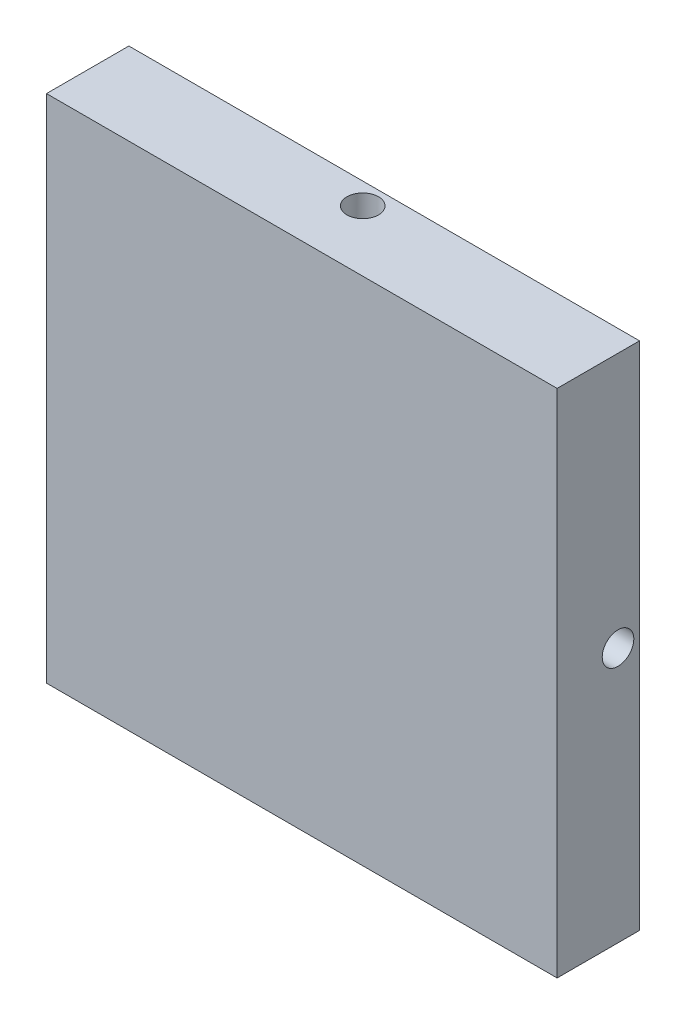
from build123d import *

# Parameters (mm, degrees)
SKETCH1_W           = 113.157
SKETCH1_H           = 113.157
BOSS_EXTRUDE1_DEPTH = 8.73125
SKETCH1_3_W         = 113.157
SKETCH1_3_H         = 113.157
SKETCH1_3_R         = 3.175
SKETCH1_3_R_2       = 51.59375
BOSS_EXTRUDE2_DEPTH = 9.525
SKETCH1_4_R         = 3.175
BOSS_EXTRUDE3_DEPTH = 18.3515
CUT_EXTRUDE1_REACH  = 129.837
SKETCH2_R           = 3.5
CIRPATTERN1_COUNT   = 4
CUT_EXTRUDE2_DEPTH  = 5.08
FILLET3_R           = 1.905


with BuildPart() as part:
    # Sketch1 → Boss-Extrude1 (new body)
    with BuildSketch(Plane.XY):
        Rectangle(SKETCH1_W, SKETCH1_H)
    extrude(amount=BOSS_EXTRUDE1_DEPTH)

    # Sketch1<3> → Boss-Extrude2 (add)
    # profile 1 of 5: a face of its own
    with BuildSketch(Plane.XY):
        Rectangle(SKETCH1_3_W, SKETCH1_3_H)
        with Locations((-43.8785, -43.8785)):
            Circle(SKETCH1_3_R, mode=Mode.SUBTRACT)
        with Locations((43.8785, -43.8785)):
            Circle(SKETCH1_3_R, mode=Mode.SUBTRACT)
        with Locations((-43.8785, 43.8785)):
            Circle(SKETCH1_3_R, mode=Mode.SUBTRACT)
        Circle(SKETCH1_3_R_2, mode=Mode.SUBTRACT)
        with Locations((43.8785, 43.8785)):
            Circle(SKETCH1_3_R, mode=Mode.SUBTRACT)
    # profile 2 of 5: a face of its own
    with BuildSketch(Plane.XY):
        with Locations((-12.900657786, -35.444265963)):
            Circle(SKETCH1_3_R)
    # profile 3 of 5: a face of its own
    with BuildSketch(Plane.XY):
        Circle(SKETCH1_3_R)
    # profile 4 of 5: a face of its own
    with BuildSketch(Plane.XY):
        with Locations((-24.24530585, 28.89443035)):
            Circle(SKETCH1_3_R)
    # profile 5 of 5: a face of its own
    with BuildSketch(Plane.XY):
        with Locations((37.145963636, 6.549835613)):
            Circle(SKETCH1_3_R)
    extrude(amount=-BOSS_EXTRUDE2_DEPTH)

    # Sketch1<4> → Boss-Extrude3 (add)
    with BuildSketch(Plane.XY):
        Circle(SKETCH1_4_R)
    extrude(amount=-BOSS_EXTRUDE3_DEPTH)

    # Sketch2 → Cut-Extrude1 (cut, up to next)
    with BuildSketch(Plane(origin=(0, 56.5785, 0), x_dir=(1, 0, 0), z_dir=(0, 1, 0)), mode=Mode.PRIVATE) as cut_extrude1_sk1:
        with Locations((0, 4.7625)):
            Circle(SKETCH2_R)
    cut_extrude1_tool1 = extrude(cut_extrude1_sk1.sketch, amount=-CUT_EXTRUDE1_REACH, mode=Mode.PRIVATE) & part.part
    cut_extrude1 = cut_extrude1_tool1.solids().sort_by_distance((0, 56.5785, -4.7625))[0]
    add(cut_extrude1, mode=Mode.SUBTRACT)

    # CirPattern1: Cut-Extrude1 ×4 about axis
    cirpattern1_axis = Axis((0, 0, -9.525), (0, 0, 1))
    for i in range(1, CIRPATTERN1_COUNT):
        add(cut_extrude1.rotate(cirpattern1_axis, i * 360 / CIRPATTERN1_COUNT), mode=Mode.SUBTRACT)

    # Sketch4 → Cut-Extrude2 (cut)
    with BuildSketch(Plane(origin=(0, 0, 0), x_dir=(-1, 0, 0), z_dir=(0, 0, -1))):
        with BuildLine():
            Line((-46.89411735, 1.27), (-25.01019592, 1.27))
            ThreePointArc((-25.01019592, 1.27), (-23.74019592, 0), (-25.01019592, -1.27))
            Line((-25.01019592, -1.27), (-46.89411735, -1.27))
            ThreePointArc((-46.89411735, -1.27), (-48.16411735, 0), (-46.89411735, 1.27))
        make_face()
    extrude(amount=-CUT_EXTRUDE2_DEPTH, mode=Mode.SUBTRACT)

    # Fillet3
    fillet3_edges = [part.edges().sort_by_distance(p)[0] for p in [
        (35.952156635, 1.27, 0),
        (23.74019592, 0, 0),
        (35.952156635, -1.27, 0),
        (48.16411735, 0, 0),
    ]]
    fillet(fillet3_edges, radius=FILLET3_R)


solid = part.part
